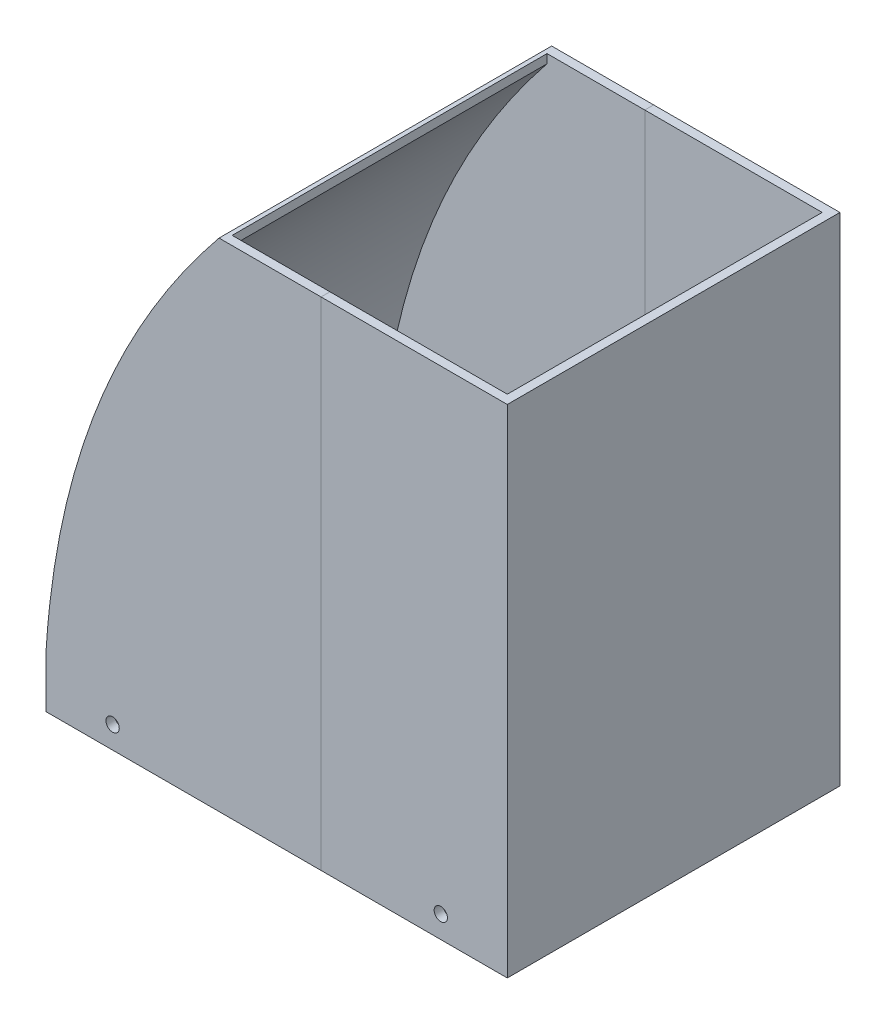
from build123d import *

# Parameters (mm, degrees)
SKETCH1_W           = 104
SKETCH1_H           = 75
BOSS_EXTRUDE2_DEPTH = 12
BOSS_EXTRUDE4_DEPTH = 75
SHELL1_START        = -35.5
SHELL1_DEPTH        = 71
SKETCH3_W           = 62.04509354
SKETCH3_H           = 71
CUT_EXTRUDE1_DEPTH  = 128.319480206
SKETCH4_R           = 1.5
CUT_EXTRUDE2_DEPTH  = 145.474911482


# Read off the part's stored shape, not the designer's step: Shell1
with BuildPart() as part:
    # Sketch1 → Boss-Extrude2 (new body)
    with BuildSketch(Plane(origin=(0, 0, 0), x_dir=(1, 0, 0), z_dir=(0, 1, 0))):
        Rectangle(SKETCH1_W, SKETCH1_H)
    extrude(amount=BOSS_EXTRUDE2_DEPTH)

    # Sketch2 → Boss-Extrude4 (add)
    with BuildSketch(Plane.XY.offset(37.5)):
        with BuildLine():
            Line((52, 12), (52, 112))
            Line((52, 112), (-13, 112))
            add(Edge.make_bspline(
                [(-13, 112), (-48.459809771, 68.363449042), (-52, 12)],
                knots=[0, 0, 0, 1, 1, 1], degree=2))
            Line((-52, 12), (52, 12))
        make_face()
    extrude(amount=-BOSS_EXTRUDE4_DEPTH)

    # Shell1 outline → Shell1 (cut)
    with BuildSketch(Plane.XY.offset(SHELL1_START)):
        with BuildLine():
            Line((50, 110), (-12.045093537, 110.000000006))
            add(Edge.make_bspline(
                [(-12.045093537, 110.000000006), (-20.670956306, 99.276173698), (-28.182222953, 88.11932571), (-34.582341912, 76.528575232), (-39.874973944, 64.50158541), (-44.063442169, 52.033775923), (-47.148080274, 39.119568406), (-49.127608799, 25.754940937), (-50, 11.937090173)],
                knots=[0.008542591, 0.008542591, 0.008542591, 0.008542591, 0.008542591, 0.008542591, 0.008542591, 0.008542591, 0.008542591, 0.999440121, 0.999440121, 0.999440121, 0.999440121, 0.999440121, 0.999440121, 0.999440121, 0.999440121, 0.999440121], degree=8))
            Line((-50, 11.937090173), (-50, 0))
            Line((-50, 0), (50, 0))
            Line((50, 0), (50, 110))
        make_face()
    extrude(amount=SHELL1_DEPTH, mode=Mode.SUBTRACT)

    # Sketch3 → Cut-Extrude1 (cut, through all)
    with BuildSketch(Plane.XZ.offset(-110)):
        with Locations((18.97745323, 0)):
            Rectangle(SKETCH3_W, SKETCH3_H)
    extrude(amount=-CUT_EXTRUDE1_DEPTH, mode=Mode.SUBTRACT)

    # Sketch4 → Cut-Extrude2 (cut, through all)
    with BuildSketch(Plane.XY.offset(37.5)):
        with Locations((-37, 5)):
            Circle(SKETCH4_R)
        with Locations((37, 5)):
            Circle(SKETCH4_R)
    extrude(amount=-CUT_EXTRUDE2_DEPTH, mode=Mode.SUBTRACT)


with BuildPart() as body_2:
    # Split1: the piece on the far side of the plane
    add(part.part)
    split(bisect_by=Plane(origin=(10, 0, 0), x_dir=(0, 0, 1), z_dir=(1, 0, 0)), keep=Keep.BOTTOM)


with BuildPart() as part_1:
    add(part.part)

    # Split1
    split(bisect_by=Plane(origin=(10, 0, 0), x_dir=(0, 0, 1), z_dir=(1, 0, 0)), keep=Keep.TOP)


solid = Compound([body_2.part, part_1.part])
